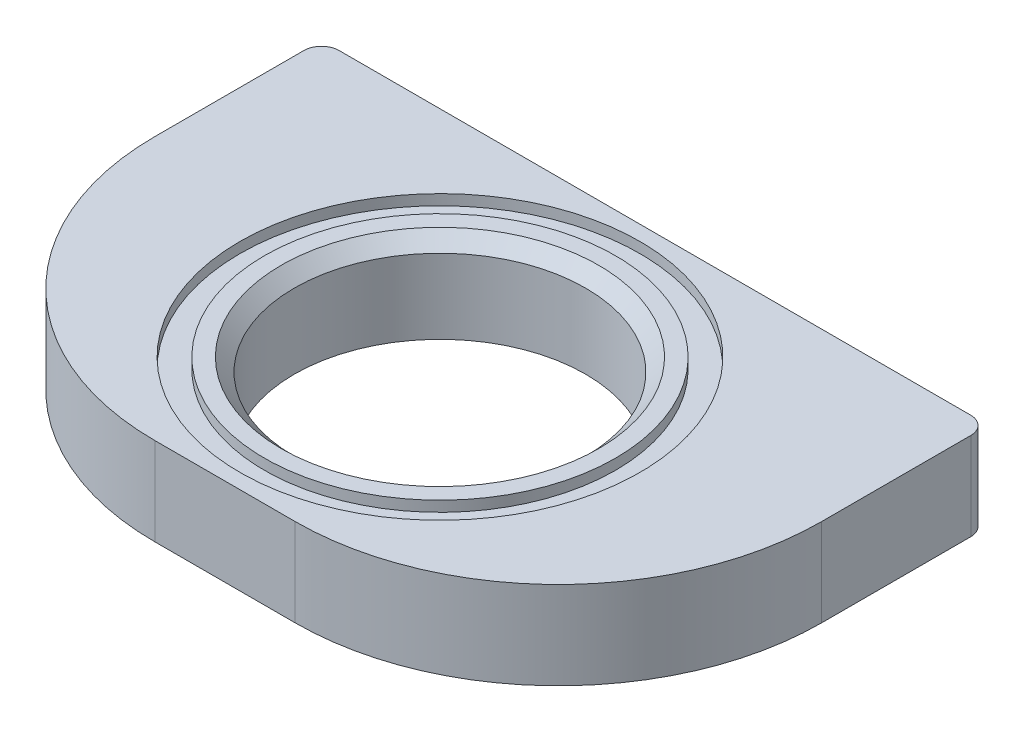
from build123d import *

# Parameters (mm, degrees)
SKETCH1_W           = 38
SKETCH1_H           = 24.5
SKETCH1_R           = 8.3
BOSS_EXTRUDE1_DEPTH = 5
FILLET1_R           = 15
FILLET2_R           = 1
CHAMFER1_SIZE       = 0.75
SKETCH3_W           = 1.4
SKETCH3_H           = 1.151259449


with BuildPart() as part:
    # Sketch1 → Boss-Extrude1 (new body)
    with BuildSketch(Plane(origin=(0, 0, 0), x_dir=(1, 0, 0), z_dir=(0, 1, 0))):
        Rectangle(SKETCH1_W, SKETCH1_H)
        Circle(SKETCH1_R, mode=Mode.SUBTRACT)
    extrude(amount=BOSS_EXTRUDE1_DEPTH)

    # Fillet1
    fillet1_edges = [part.edges().sort_by_distance(p)[0] for p in [
        (19, 2.5, 12.25),
        (-19, 2.5, 12.25),
    ]]
    fillet(fillet1_edges, radius=FILLET1_R)

    # Fillet2
    fillet2_edges = [part.edges().sort_by_distance(p)[0] for p in [
        (-19, 2.5, -12.25),
        (19, 2.5, -12.25),
    ]]
    fillet(fillet2_edges, radius=FILLET2_R)

    # Chamfer1
    chamfer1_edges = [part.edges().sort_by_distance(p)[0] for p in [
        (-8.3, 5, 0),
    ]]
    chamfer(chamfer1_edges, length=CHAMFER1_SIZE)

    # o-ring: sweep along a path in Sketch4
    with BuildLine(Plane(origin=(0, 5, 0), x_dir=(1, 0, 0), z_dir=(0, 1, 0))) as o_ring_path:
        CenterArc((0, 0), 11, 0, 360)
    # Sketch3 → o-ring (sweep, cut)
    with BuildSketch(Plane.XY):
        with Locations((-10.7, 4.975629725)):
            Rectangle(SKETCH3_W, SKETCH3_H)
    sweep(path=o_ring_path.line, mode=Mode.SUBTRACT)


solid = part.part
